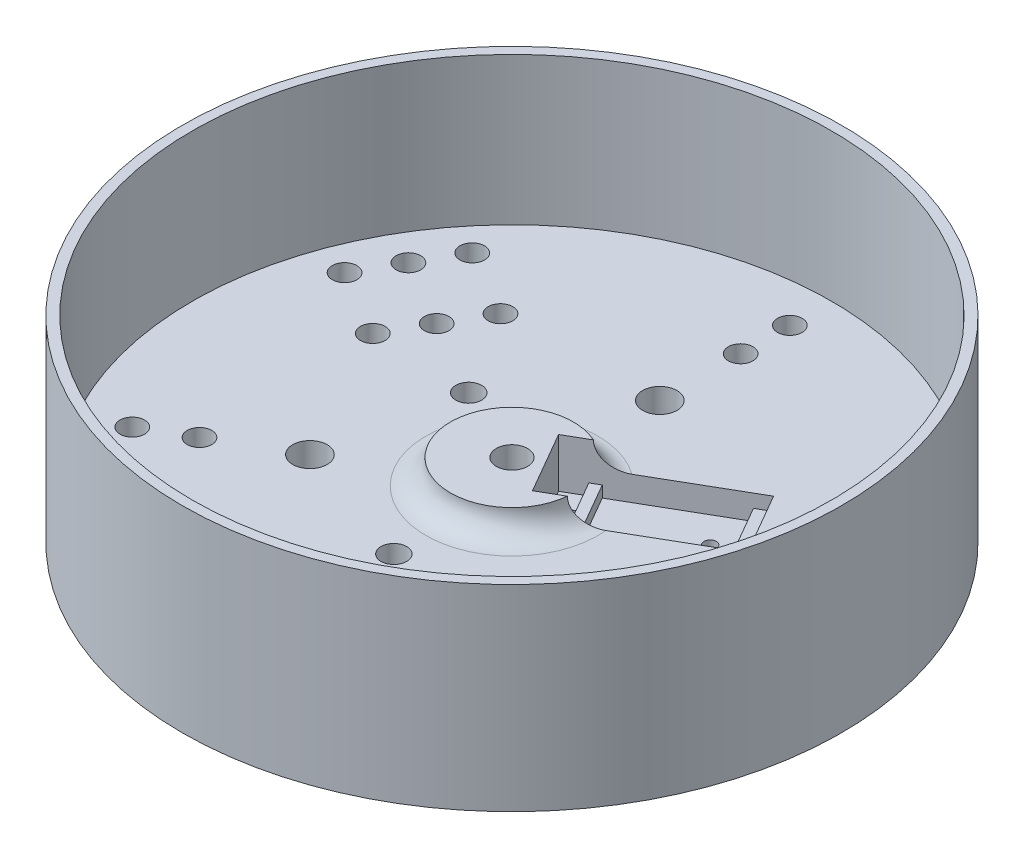
from build123d import *

# Parameters (mm, degrees)
BOSS_EXTRUDE7_DEPTH  = 10
SKETCH1_23_R         = 65.000000017
SKETCH1_23_R_2       = 4.125
BOSS_EXTRUDE8_DEPTH  = 10
CUT_EXTRUDE1_START   = 65
SKETCH16_R           = 2.5
CUT_EXTRUDE1_DEPTH   = 20
BOSS_EXTRUDE9_START  = -0.5
SKETCH17_R           = 12.5
SKETCH17_R_2         = 3.175
BOSS_EXTRUDE9_DEPTH  = 5.5
FILLET1_R            = 5
SKETCH18_R           = 2.5
SKETCH18_R_2         = 3.5
CUT_EXTRUDE2_DEPTH   = 10
SKETCH20_R           = 2.625
CUT_EXTRUDE11_DEPTH  = 25
SKETCH1_24_R         = 67
SKETCH1_24_R_2       = 66.5
BOSS_EXTRUDE10_DEPTH = 40
CUT_EXTRUDE12_START  = -0.2
CUT_EXTRUDE12_DEPTH  = 50
CUT_EXTRUDE13_START  = -5
SKETCH21_3_R         = 1.25
CUT_EXTRUDE13_DEPTH  = 15
CUT_EXTRUDE14_START  = -7.3
CUT_EXTRUDE14_DEPTH  = 15
SKETCH21_5_R         = 1.25
CUT_EXTRUDE15_DEPTH  = 15


with BuildPart() as part:
    # Sketch1 → Boss-Extrude7 (new body)
    with BuildSketch(Plane(origin=(0, 0, 0), x_dir=(1, 0, 0), z_dir=(0, 1, 0))):
        with BuildLine():
            ThreePointArc((-10.099280768, -64.210626285), (-56.291651246, -32.5), (-60.65767394, 23.359079438))
            Line((-60.65767394, 23.359079438), (-64.257390064, 17.124188218))
            ThreePointArc((-64.257390064, 17.124188218), (-57.590689352, -33.25), (-17.298713017, -64.210626285))
            Line((-17.298713017, -64.210626285), (-10.099280768, -64.210626285))
        make_face()
        with BuildLine():
            Line((-64.257390064, 17.124188218), (-60.65767394, 23.359079438))
            ThreePointArc((-60.65767394, 23.359079438), (-60.639599413, 23.405960416), (-60.621488653, 23.452827409))
            Line((-60.621488653, 23.452827409), (-61.93581913, 24.211656463))
            ThreePointArc((-61.93581913, 24.211656463), (-63.196040724, 20.700493636), (-64.257390064, 17.124188218))
        make_face()
        with BuildLine():
            ThreePointArc((-60.621488653, 23.452827409), (-59.667920988, 25.782536821), (-58.624860802, 28.073576473))
            ThreePointArc((-58.624860802, 28.073576473), (-54.991019149, 34.65527107), (-50.621488653, 40.773335485))
            Line((-50.621488653, 40.773335485), (-51.93581913, 41.532164539))
            ThreePointArc((-51.93581913, 41.532164539), (-57.590689352, 33.25), (-61.93581913, 24.211656463))
            Line((-61.93581913, 24.211656463), (-60.621488653, 23.452827409))
        make_face()
        with BuildLine():
            ThreePointArc((-50.621488653, 40.773335485), (-50.589956027, 40.812453359), (-50.558393172, 40.851546848))
            Line((-50.558393172, 40.851546848), (-46.958677048, 47.086438068))
            ThreePointArc((-46.958677048, 47.086438068), (-49.525173722, 44.379129868), (-51.93581913, 41.532164539))
            Line((-51.93581913, 41.532164539), (-50.621488653, 40.773335485))
        make_face()
        with BuildLine():
            Line((-46.958677048, 47.086438068), (-50.558393172, 40.851546848))
            ThreePointArc((-50.558393172, 40.851546848), (0, 65), (50.558393172, 40.851546848))
            Line((50.558393172, 40.851546848), (46.958677048, 47.086438068))
            ThreePointArc((46.958677048, 47.086438068), (0, 66.5), (-46.958677048, 47.086438068))
        make_face()
        with BuildLine():
            Line((46.958677048, 47.086438068), (50.558393172, 40.851546848))
            ThreePointArc((50.558393172, 40.851546848), (50.589956027, 40.812453359), (50.621488653, 40.773335485))
            Line((50.621488653, 40.773335485), (51.93581913, 41.532164539))
            ThreePointArc((51.93581913, 41.532164539), (49.525173722, 44.379129868), (46.958677048, 47.086438068))
        make_face()
        with BuildLine():
            Line((51.93581913, 41.532164539), (50.621488653, 40.773335485))
            ThreePointArc((50.621488653, 40.773335485), (52.162292355, 38.782666956), (53.624860802, 36.733830511))
            ThreePointArc((53.624860802, 36.733830511), (57.507854696, 30.295984028), (60.621488653, 23.452827409))
            Line((60.621488653, 23.452827409), (61.93581913, 24.211656463))
            ThreePointArc((61.93581913, 24.211656463), (57.590689352, 33.25), (51.93581913, 41.532164539))
        make_face()
        with BuildLine():
            ThreePointArc((64.257390064, 17.124188218), (63.196040724, 20.700493636), (61.93581913, 24.211656463))
            Line((61.93581913, 24.211656463), (60.621488653, 23.452827409))
            ThreePointArc((60.621488653, 23.452827409), (60.639599413, 23.405960416), (60.65767394, 23.359079438))
            Line((60.65767394, 23.359079438), (64.257390064, 17.124188218))
        make_face()
        with BuildLine():
            ThreePointArc((66.5, 0), (65.936963986, 8.635205867), (64.257390064, 17.124188218))
            Line((64.257390064, 17.124188218), (60.65767394, 23.359079438))
            ThreePointArc((60.65767394, 23.359079438), (63.90519856, 11.879629495), (65, 0))
            ThreePointArc((65, 0), (49.40371064, -42.240660211), (10.099280768, -64.210626285))
            Line((10.099280768, -64.210626285), (17.298713017, -64.210626285))
            ThreePointArc((17.298713017, -64.210626285), (52.785482927, -40.44678964), (66.5, 0))
        make_face()
        with BuildLine():
            ThreePointArc((-10, -64.226162893), (-10.049643386, -64.218413775), (-10.099280768, -64.210626285))
            Line((-10.099280768, -64.210626285), (-17.298713017, -64.210626285))
            ThreePointArc((-17.298713017, -64.210626285), (-13.670867002, -65.079623504), (-10, -65.743821002))
            Line((-10, -65.743821002), (-10, -64.226162893))
        make_face()
        with BuildLine():
            ThreePointArc((5, -64.807406984), (-2.516835548, -64.951255098), (-10, -64.226162893))
            Line((-10, -64.226162893), (-10, -65.743821002))
            ThreePointArc((-10, -65.743821002), (0, -66.5), (10, -65.743821002))
            Line((10, -65.743821002), (10, -64.226162893))
            ThreePointArc((10, -64.226162893), (7.505628633, -64.565203777), (5, -64.807406984))
        make_face()
        with BuildLine():
            Line((10, -64.226162893), (10, -65.743821002))
            ThreePointArc((10, -65.743821002), (13.670867002, -65.079623504), (17.298713017, -64.210626285))
            Line((17.298713017, -64.210626285), (10.099280768, -64.210626285))
            ThreePointArc((10.099280768, -64.210626285), (10.049643386, -64.218413775), (10, -64.226162893))
        make_face()
    extrude(amount=BOSS_EXTRUDE7_DEPTH)

    # Sketch1<23> → Boss-Extrude8 (add)
    with BuildSketch(Plane(origin=(0, 0, 0), x_dir=(1, 0, 0), z_dir=(0, 1, 0))):
        with Locations((-3e-09, 1.7e-08)):
            Circle(SKETCH1_23_R)
        with Locations(Location((0, 0, 0), (0, 0, 270))):
            Circle(SKETCH1_23_R_2, mode=Mode.SUBTRACT)
    extrude(amount=BOSS_EXTRUDE8_DEPTH)

    # Sketch16 → Cut-Extrude1 (cut)
    with BuildSketch(Plane.XZ.offset(-75).offset(CUT_EXTRUDE1_START)):
        with Locations(Location((-40.967182386, -12.682758664, 0), (0, 0, 90))):
            Circle(SKETCH16_R)
        with Locations(Location((-36.217182386, -20.91, 0), (0, 0, 90))):
            Circle(SKETCH16_R)
        with Locations(Location((-49.796460718, -28.75, 0), (0, 0, 90))):
            Circle(SKETCH16_R)
        with Locations(Location((0, 41.82, 0), (0, 0, 90))):
            Circle(SKETCH16_R)
        with Locations(Location((0, 57.5, 0), (0, 0, 90))):
            Circle(SKETCH16_R)
        with Locations(Location((-31.467182386, -29.137241336, 0), (0, 0, 90))):
            Circle(SKETCH16_R)
        with Locations(Location((-45.046460718, -36.977241336, 0), (0, 0, 90))):
            Circle(SKETCH16_R)
        with Locations(Location((-54.546460718, -20.522758664, 0), (0, 0, 90))):
            Circle(SKETCH16_R)
        with Locations(Location((9.5, 41.82, 0), (0, 0, 90))):
            Circle(SKETCH16_R)
        with Locations(Location((-9.5, 41.82, 0), (0, 0, 90))):
            Circle(SKETCH16_R)
        with Locations(Location((-9.5, 57.5, 0), (0, 0, 90))):
            Circle(SKETCH16_R)
        with Locations(Location((9.5, 57.5, 0), (0, 0, 90))):
            Circle(SKETCH16_R)
    extrude(amount=CUT_EXTRUDE1_DEPTH, mode=Mode.SUBTRACT)

    # Sketch17 → Boss-Extrude9 (add)
    with BuildSketch(Plane(origin=(0, 10, 0), x_dir=(1, 0, 0), z_dir=(0, 1, 0)).offset(BOSS_EXTRUDE9_START)):
        with Locations(Location((0, 0, 0), (0, 0, 270))):
            Circle(SKETCH17_R)
        with Locations(Location((0, 0, 0), (0, 0, 270))):
            Circle(SKETCH17_R_2, mode=Mode.SUBTRACT)
    extrude(amount=BOSS_EXTRUDE9_DEPTH)

    # Fillet1
    fillet1_edges = [part.edges().sort_by_distance(p)[0] for p in [
        (0, 10, -12.5),
    ]]
    fillet(fillet1_edges, radius=FILLET1_R - 0.0001)  # a hair under: the kernel refuses the full size

    # Sketch18 → Cut-Extrude2 (cut)
    with BuildSketch(Plane(origin=(0, 10, 0), x_dir=(1, 0, 0), z_dir=(0, 1, 0))):
        with Locations(Location((0, 56.5, 0), (0, 0, 270))):
            Circle(SKETCH18_R)
        with Locations(Location((0, 46.5, 0), (0, 0, 270))):
            Circle(SKETCH18_R)
        with Locations(Location((40.270181276, -23.25, 0), (0, 0, 270))):
            Circle(SKETCH18_R)
        with Locations(Location((48.930435314, -28.25, 0), (0, 0, 270))):
            Circle(SKETCH18_R)
        with Locations(Location((-40.270181276, -23.25, 0), (0, 0, 270))):
            Circle(SKETCH18_R)
        with Locations(Location((-48.930435314, -28.25, 0), (0, 0, 270))):
            Circle(SKETCH18_R)
        with Locations(Location((26.035163591, -15.031408708, 0), (0, 0, 270))):
            Circle(SKETCH18_R_2)
        with Locations(Location((-26.035163591, -15.031408708, 0), (0, 0, 270))):
            Circle(SKETCH18_R_2)
        with Locations(Location((0, 30.062817415, 0), (0, 0, 270))):
            Circle(SKETCH18_R_2)
    extrude(amount=-CUT_EXTRUDE2_DEPTH, mode=Mode.SUBTRACT)

    # Sketch20 → Cut-Extrude11 (cut)
    with BuildSketch(Plane(origin=(0, 10, 0), x_dir=(1, 0, 0), z_dir=(0, 1, 0))):
        with Locations(Location((-20.784609691, 12, 0), (0, 0, 270))):
            Circle(SKETCH20_R)
        with Locations(Location((0, -24, 0), (0, 0, 270))):
            Circle(SKETCH20_R)
    extrude(amount=-CUT_EXTRUDE11_DEPTH, mode=Mode.SUBTRACT)

    # Sketch1<24> → Boss-Extrude10 (add)
    # profile 1 of 13: a face of its own
    with BuildSketch(Plane(origin=(0, 0, 0), x_dir=(1, 0, 0), z_dir=(0, 1, 0))):
        with Locations(Location((0, 0, 0), (0, 0, 270))):
            Circle(SKETCH1_24_R)
        Circle(SKETCH1_24_R_2, mode=Mode.SUBTRACT)
    # profile 2 of 13: a face of its own
    with BuildSketch(Plane(origin=(0, 0, 0), x_dir=(1, 0, 0), z_dir=(0, 1, 0))):
        with BuildLine():
            ThreePointArc((-10.099280768, -64.210626285), (-56.291651246, -32.5), (-60.65767394, 23.359079438))
            Line((-60.65767394, 23.359079438), (-64.257390064, 17.124188218))
            ThreePointArc((-64.257390064, 17.124188218), (-57.590689352, -33.25), (-17.298713017, -64.210626285))
            Line((-17.298713017, -64.210626285), (-10.099280768, -64.210626285))
        make_face()
    # profile 3 of 13: a face of its own
    with BuildSketch(Plane(origin=(0, 0, 0), x_dir=(1, 0, 0), z_dir=(0, 1, 0))):
        with BuildLine():
            Line((-64.257390064, 17.124188218), (-60.65767394, 23.359079438))
            ThreePointArc((-60.65767394, 23.359079438), (-60.639599413, 23.405960416), (-60.621488653, 23.452827409))
            Line((-60.621488653, 23.452827409), (-61.93581913, 24.211656463))
            ThreePointArc((-61.93581913, 24.211656463), (-63.196040724, 20.700493636), (-64.257390064, 17.124188218))
        make_face()
    # profile 4 of 13: a face of its own
    with BuildSketch(Plane(origin=(0, 0, 0), x_dir=(1, 0, 0), z_dir=(0, 1, 0))):
        with BuildLine():
            ThreePointArc((-60.621488653, 23.452827409), (-59.667920988, 25.782536821), (-58.624860802, 28.073576473))
            ThreePointArc((-58.624860802, 28.073576473), (-54.991019149, 34.65527107), (-50.621488653, 40.773335485))
            Line((-50.621488653, 40.773335485), (-51.93581913, 41.532164539))
            ThreePointArc((-51.93581913, 41.532164539), (-57.590689352, 33.25), (-61.93581913, 24.211656463))
            Line((-61.93581913, 24.211656463), (-60.621488653, 23.452827409))
        make_face()
    # profile 5 of 13: a face of its own
    with BuildSketch(Plane(origin=(0, 0, 0), x_dir=(1, 0, 0), z_dir=(0, 1, 0))):
        with BuildLine():
            ThreePointArc((-50.621488653, 40.773335485), (-50.589956027, 40.812453359), (-50.558393172, 40.851546848))
            Line((-50.558393172, 40.851546848), (-46.958677048, 47.086438068))
            ThreePointArc((-46.958677048, 47.086438068), (-49.525173722, 44.379129868), (-51.93581913, 41.532164539))
            Line((-51.93581913, 41.532164539), (-50.621488653, 40.773335485))
        make_face()
    # profile 6 of 13: a face of its own
    with BuildSketch(Plane(origin=(0, 0, 0), x_dir=(1, 0, 0), z_dir=(0, 1, 0))):
        with BuildLine():
            Line((-46.958677048, 47.086438068), (-50.558393172, 40.851546848))
            ThreePointArc((-50.558393172, 40.851546848), (0, 65), (50.558393172, 40.851546848))
            Line((50.558393172, 40.851546848), (46.958677048, 47.086438068))
            ThreePointArc((46.958677048, 47.086438068), (0, 66.5), (-46.958677048, 47.086438068))
        make_face()
    # profile 7 of 13: a face of its own
    with BuildSketch(Plane(origin=(0, 0, 0), x_dir=(1, 0, 0), z_dir=(0, 1, 0))):
        with BuildLine():
            Line((46.958677048, 47.086438068), (50.558393172, 40.851546848))
            ThreePointArc((50.558393172, 40.851546848), (50.589956027, 40.812453359), (50.621488653, 40.773335485))
            Line((50.621488653, 40.773335485), (51.93581913, 41.532164539))
            ThreePointArc((51.93581913, 41.532164539), (49.525173722, 44.379129868), (46.958677048, 47.086438068))
        make_face()
    # profile 8 of 13: a face of its own
    with BuildSketch(Plane(origin=(0, 0, 0), x_dir=(1, 0, 0), z_dir=(0, 1, 0))):
        with BuildLine():
            Line((51.93581913, 41.532164539), (50.621488653, 40.773335485))
            ThreePointArc((50.621488653, 40.773335485), (52.162292355, 38.782666956), (53.624860802, 36.733830511))
            ThreePointArc((53.624860802, 36.733830511), (57.507854696, 30.295984028), (60.621488653, 23.452827409))
            Line((60.621488653, 23.452827409), (61.93581913, 24.211656463))
            ThreePointArc((61.93581913, 24.211656463), (57.590689352, 33.25), (51.93581913, 41.532164539))
        make_face()
    # profile 9 of 13: a face of its own
    with BuildSketch(Plane(origin=(0, 0, 0), x_dir=(1, 0, 0), z_dir=(0, 1, 0))):
        with BuildLine():
            ThreePointArc((64.257390064, 17.124188218), (63.196040724, 20.700493636), (61.93581913, 24.211656463))
            Line((61.93581913, 24.211656463), (60.621488653, 23.452827409))
            ThreePointArc((60.621488653, 23.452827409), (60.639599413, 23.405960416), (60.65767394, 23.359079438))
            Line((60.65767394, 23.359079438), (64.257390064, 17.124188218))
        make_face()
    # profile 10 of 13: a face of its own
    with BuildSketch(Plane(origin=(0, 0, 0), x_dir=(1, 0, 0), z_dir=(0, 1, 0))):
        with BuildLine():
            ThreePointArc((66.5, 0), (65.936963986, 8.635205867), (64.257390064, 17.124188218))
            Line((64.257390064, 17.124188218), (60.65767394, 23.359079438))
            ThreePointArc((60.65767394, 23.359079438), (63.90519856, 11.879629495), (65, 0))
            ThreePointArc((65, 0), (49.40371064, -42.240660211), (10.099280768, -64.210626285))
            Line((10.099280768, -64.210626285), (17.298713017, -64.210626285))
            ThreePointArc((17.298713017, -64.210626285), (52.785482927, -40.44678964), (66.5, 0))
        make_face()
    # profile 11 of 13: a face of its own
    with BuildSketch(Plane(origin=(0, 0, 0), x_dir=(1, 0, 0), z_dir=(0, 1, 0))):
        with BuildLine():
            Line((10, -64.226162893), (10, -65.743821002))
            ThreePointArc((10, -65.743821002), (13.670867002, -65.079623504), (17.298713017, -64.210626285))
            Line((17.298713017, -64.210626285), (10.099280768, -64.210626285))
            ThreePointArc((10.099280768, -64.210626285), (10.049643386, -64.218413775), (10, -64.226162893))
        make_face()
    # profile 12 of 13: a face of its own
    with BuildSketch(Plane(origin=(0, 0, 0), x_dir=(1, 0, 0), z_dir=(0, 1, 0))):
        with BuildLine():
            ThreePointArc((5, -64.807406984), (-2.516835548, -64.951255098), (-10, -64.226162893))
            Line((-10, -64.226162893), (-10, -65.743821002))
            ThreePointArc((-10, -65.743821002), (0, -66.5), (10, -65.743821002))
            Line((10, -65.743821002), (10, -64.226162893))
            ThreePointArc((10, -64.226162893), (7.505628633, -64.565203777), (5, -64.807406984))
        make_face()
    # profile 13 of 13: a face of its own
    with BuildSketch(Plane(origin=(0, 0, 0), x_dir=(1, 0, 0), z_dir=(0, 1, 0))):
        with BuildLine():
            ThreePointArc((-10, -64.226162893), (-10.049643386, -64.218413775), (-10.099280768, -64.210626285))
            Line((-10.099280768, -64.210626285), (-17.298713017, -64.210626285))
            ThreePointArc((-17.298713017, -64.210626285), (-13.670867002, -65.079623504), (-10, -65.743821002))
            Line((-10, -65.743821002), (-10, -64.226162893))
        make_face()
    extrude(amount=BOSS_EXTRUDE10_DEPTH)

    # Sketch21 → Cut-Extrude12 (cut)
    with BuildSketch(Plane.XZ.offset(CUT_EXTRUDE12_START)):
        with BuildLine():
            ThreePointArc((6.670582503, -2.446212189), (7.71570323, -2.636009989), (8.40263331, -3.446212189))
            Line((8.40263331, -3.446212189), (9.419228634, -1.685417438))
            Line((9.419228634, -1.685417438), (7.687177826, -0.685417438))
            Line((7.687177826, -0.685417438), (6.670582503, -2.446212189))
        make_face()
        with BuildLine():
            ThreePointArc((5.45377315, -4.553787811), (6.14070323, -5.363990011), (7.185823958, -5.553787811))
            Line((7.185823958, -5.553787811), (8.40263331, -3.446212189))
            ThreePointArc((8.40263331, -3.446212189), (7.71570323, -2.636009989), (6.670582503, -2.446212189))
            Line((6.670582503, -2.446212189), (5.45377315, -4.553787811))
        make_face()
        with BuildLine():
            Line((6.169228634, -7.314582562), (7.185823958, -5.553787811))
            ThreePointArc((7.185823958, -5.553787811), (6.14070323, -5.363990011), (5.45377315, -4.553787811))
            Line((5.45377315, -4.553787811), (4.437177826, -6.314582562))
            Line((4.437177826, -6.314582562), (6.169228634, -7.314582562))
        make_face()
    extrude(amount=-CUT_EXTRUDE12_DEPTH, mode=Mode.SUBTRACT)

    # Sketch21<3> → Cut-Extrude13 (cut)
    # profile 1 of 4: a face of its own
    with BuildSketch(Plane.XZ.offset(CUT_EXTRUDE13_START)):
        with BuildLine():
            Line((0.705127019, -8.778684177), (4.602241336, -11.028684177))
            Line((4.602241336, -11.028684177), (7.987124177, -5.165895119))
            ThreePointArc((7.987124177, -5.165895119), (7.614450766, -5.417635115), (7.185823958, -5.553787811))
            Line((7.185823958, -5.553787811), (6.169228634, -7.314582562))
            Line((6.169228634, -7.314582562), (4.437177826, -6.314582562))
            Line((4.437177826, -6.314582562), (5.45377315, -4.553787811))
            ThreePointArc((5.45377315, -4.553787811), (5.564213219, -3.2125), (6.670582503, -2.446212189))
            Line((6.670582503, -2.446212189), (7.687177826, -0.685417438))
            Line((7.687177826, -0.685417438), (9.419228634, -1.685417438))
            Line((9.419228634, -1.685417438), (8.40263331, -3.446212189))
            ThreePointArc((8.40263331, -3.446212189), (8.477856801, -3.718577165), (8.50320323, -4))
            ThreePointArc((8.50320323, -4), (8.494216407, -4.168011098), (8.467358495, -4.334104881))
            Line((8.467358495, -4.334104881), (11.852241336, 1.528684177))
            Line((11.852241336, 1.528684177), (7.955127019, 3.778684177))
            Line((7.955127019, 3.778684177), (0.705127019, -8.778684177))
        make_face()
    # profile 2 of 4: a face of its own
    with BuildSketch(Plane.XZ.offset(CUT_EXTRUDE13_START)):
        Polygon((6.334292144, -12.028684177), (25.819863729, -23.278684177), (33.069863729, -10.721315823), (13.584292144, 0.528684177), align=None)
        with Locations(Location((25.547749412, -14.75, 0), (0, 0, 270))):
            Circle(SKETCH21_3_R, mode=Mode.SUBTRACT)
    # profile 3 of 4: a face of its own
    with BuildSketch(Plane.XZ.offset(CUT_EXTRUDE13_START)):
        with BuildLine():
            ThreePointArc((6.670582503, -2.446212189), (5.564213219, -3.2125), (5.45377315, -4.553787811))
            Line((5.45377315, -4.553787811), (6.670582503, -2.446212189))
        make_face()
    # profile 4 of 4: a face of its own
    with BuildSketch(Plane.XZ.offset(CUT_EXTRUDE13_START)):
        with BuildLine():
            ThreePointArc((7.185823958, -5.553787811), (7.614450766, -5.417635115), (7.987124177, -5.165895119))
            Line((7.987124177, -5.165895119), (8.467358495, -4.334104881))
            ThreePointArc((8.467358495, -4.334104881), (8.494216407, -4.168011098), (8.50320323, -4))
            ThreePointArc((8.50320323, -4), (8.477856801, -3.718577165), (8.40263331, -3.446212189))
            Line((8.40263331, -3.446212189), (7.185823958, -5.553787811))
        make_face()
    extrude(amount=-CUT_EXTRUDE13_DEPTH, mode=Mode.SUBTRACT)

    # Sketch21<4> → Cut-Extrude14 (cut)
    with BuildSketch(Plane.XZ.offset(CUT_EXTRUDE14_START)):
        with BuildLine():
            Line((4.602241336, -11.028684177), (6.334292144, -12.028684177))
            Line((6.334292144, -12.028684177), (13.584292144, 0.528684177))
            Line((13.584292144, 0.528684177), (11.852241336, 1.528684177))
            Line((11.852241336, 1.528684177), (8.467358495, -4.334104881))
            ThreePointArc((8.467358495, -4.334104881), (8.292193241, -4.7875), (7.987124177, -5.165895119))
            Line((7.987124177, -5.165895119), (4.602241336, -11.028684177))
        make_face()
        Polygon((25.819863729, -23.278684177), (28.41793994, -24.778684177), (35.66793994, -12.221315823), (33.069863729, -10.721315823), align=None)
        with BuildLine():
            Line((8.467358495, -4.334104881), (7.987124177, -5.165895119))
            ThreePointArc((7.987124177, -5.165895119), (8.292193241, -4.7875), (8.467358495, -4.334104881))
        make_face()
    extrude(amount=-CUT_EXTRUDE14_DEPTH, mode=Mode.SUBTRACT)

    # Sketch21<5> → Cut-Extrude15 (cut)
    with BuildSketch(Plane.XZ):
        with Locations(Location((25.547749412, -14.75, 0), (0, 0, 270))):
            Circle(SKETCH21_5_R)
    extrude(amount=-CUT_EXTRUDE15_DEPTH, mode=Mode.SUBTRACT)


solid = part.part
